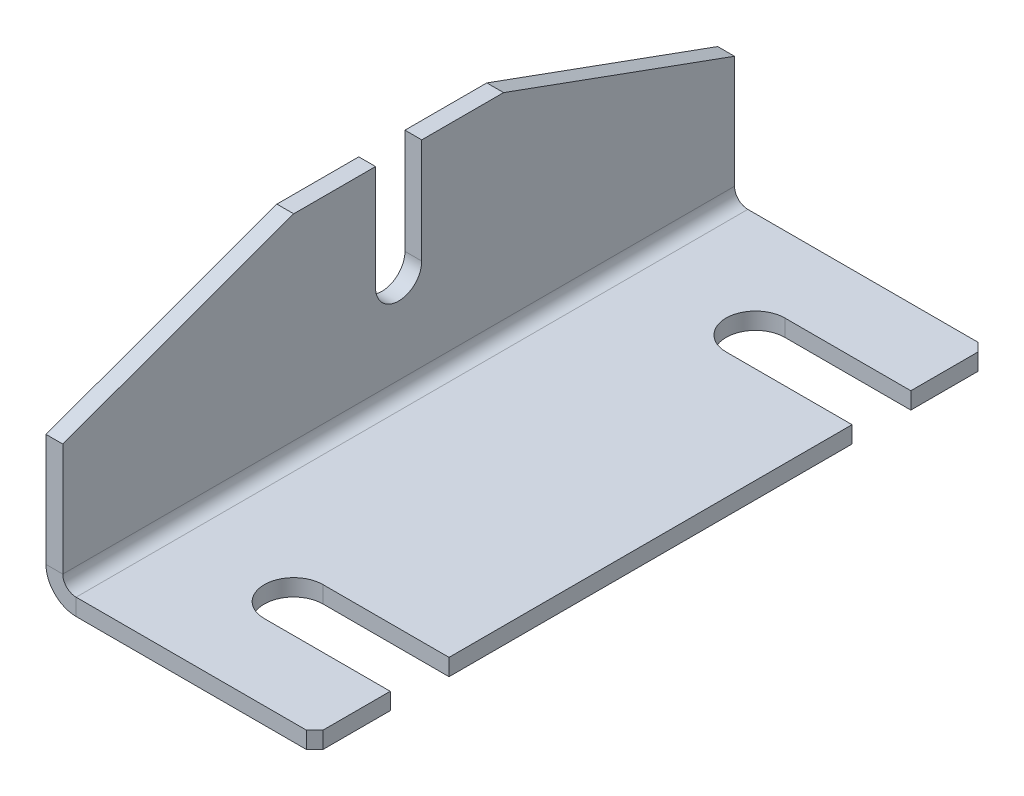
from build123d import *

# Parameters (mm, degrees)
BASE_FLANGE1_DEPTH = 80
CUT_EXTRUDE1_REACH = 113.803
CUT_EXTRUDE2_REACH = 113.803
CUT_EXTRUDE3_REACH = 113.803
CHAMFER1_SIZE      = 2


# Sheet-metal steps are written as plain solids
with BuildPart() as part:
    # Sketch1 → Base-Flange1 (new, symmetric)
    with BuildSketch(Plane.XY):
        with BuildLine():
            Line((60, 0), (3.175, 0))
            ThreePointArc((3.175, 0), (0.92993597, 0.92993597), (0, 3.175))
            Line((0, 3.175), (0, 50))
            Line((0, 50), (-4, 50))
            Line((-4, 50), (-4, 3.175))
            ThreePointArc((-4, 3.175), (-1.898491155, -1.898491155), (3.175, -4))
            Line((3.175, -4), (60, -4))
            Line((60, -4), (60, 0))
        make_face()
    extrude(amount=BASE_FLANGE1_DEPTH, both=True)

    # Sketch6 → Cut-Extrude1 (cut, up to next)
    with BuildSketch(Plane(origin=(0, 0, 0), x_dir=(0, 0, -1), z_dir=(1, 0, 0)), mode=Mode.PRIVATE) as cut_extrude1_sk1:
        with BuildLine():
            Line((5.5, 25), (5.5, 50))
            Line((5.5, 50), (-5.5, 50))
            Line((-5.5, 50), (-5.5, 25))
            ThreePointArc((-5.5, 25), (0, 19.5), (5.5, 25))
        make_face()
    cut_extrude1_tool1 = extrude(cut_extrude1_sk1.sketch, amount=-CUT_EXTRUDE1_REACH, mode=Mode.PRIVATE) & part.part
    add(cut_extrude1_tool1.solids().sort_by_distance((0, 35.314457, 0))[0], mode=Mode.SUBTRACT)

    # Sketch8 → Cut-Extrude2 (cut, up to next)
    with BuildSketch(Plane(origin=(0, 0, 0), x_dir=(0, 0, -1), z_dir=(1, 0, 0)), mode=Mode.PRIVATE) as cut_extrude2_sk1:
        Polygon((-80, 30), (-25, 50), (-80, 50), align=None)
    cut_extrude2_tool1 = extrude(cut_extrude2_sk1.sketch, amount=-CUT_EXTRUDE2_REACH, mode=Mode.PRIVATE) & part.part
    # Sketch8 → Cut-Extrude2 (cut, up to next)
    with BuildSketch(Plane(origin=(0, 0, 0), x_dir=(0, 0, -1), z_dir=(1, 0, 0)), mode=Mode.PRIVATE) as cut_extrude2_sk2:
        Polygon((25, 50), (80, 30), (80, 50), align=None)
    cut_extrude2_tool2 = extrude(cut_extrude2_sk2.sketch, amount=-CUT_EXTRUDE2_REACH, mode=Mode.PRIVATE) & part.part
    add(cut_extrude2_tool1.solids().sort_by_distance((0, 43.333333, 61.666667))[0], mode=Mode.SUBTRACT)
    add(cut_extrude2_tool2.solids().sort_by_distance((0, 43.333333, -61.666667))[0], mode=Mode.SUBTRACT)

    # Sketch9 → Cut-Extrude3 (cut, up to next)
    with BuildSketch(Plane(origin=(0, 0, 0), x_dir=(1, 0, 0), z_dir=(0, 1, 0)), mode=Mode.PRIVATE) as cut_extrude3_sk1:
        with BuildLine():
            Line((30, 62), (60, 62))
            Line((60, 62), (60, 48))
            Line((60, 48), (30, 48))
            ThreePointArc((30, 48), (23, 55), (30, 62))
        make_face()
    cut_extrude3_tool1 = extrude(cut_extrude3_sk1.sketch, amount=-CUT_EXTRUDE3_REACH, mode=Mode.PRIVATE) & part.part
    # Sketch9 → Cut-Extrude3 (cut, up to next)
    with BuildSketch(Plane(origin=(0, 0, 0), x_dir=(1, 0, 0), z_dir=(0, 1, 0)), mode=Mode.PRIVATE) as cut_extrude3_sk2:
        with BuildLine():
            Line((30, -48), (60, -48))
            Line((60, -48), (60, -62))
            Line((60, -62), (30, -62))
            ThreePointArc((30, -62), (23, -55), (30, -48))
        make_face()
    cut_extrude3_tool2 = extrude(cut_extrude3_sk2.sketch, amount=-CUT_EXTRUDE3_REACH, mode=Mode.PRIVATE) & part.part
    add(cut_extrude3_tool1.solids().sort_by_distance((42.216724, 0, -55))[0], mode=Mode.SUBTRACT)
    add(cut_extrude3_tool2.solids().sort_by_distance((42.216724, 0, 55))[0], mode=Mode.SUBTRACT)

    # Chamfer1
    chamfer1_edges = [part.edges().sort_by_distance(p)[0] for p in [
        (60, -2, 80),
        (60, -2, -80),
    ]]
    chamfer(chamfer1_edges, length=CHAMFER1_SIZE)


solid = part.part
